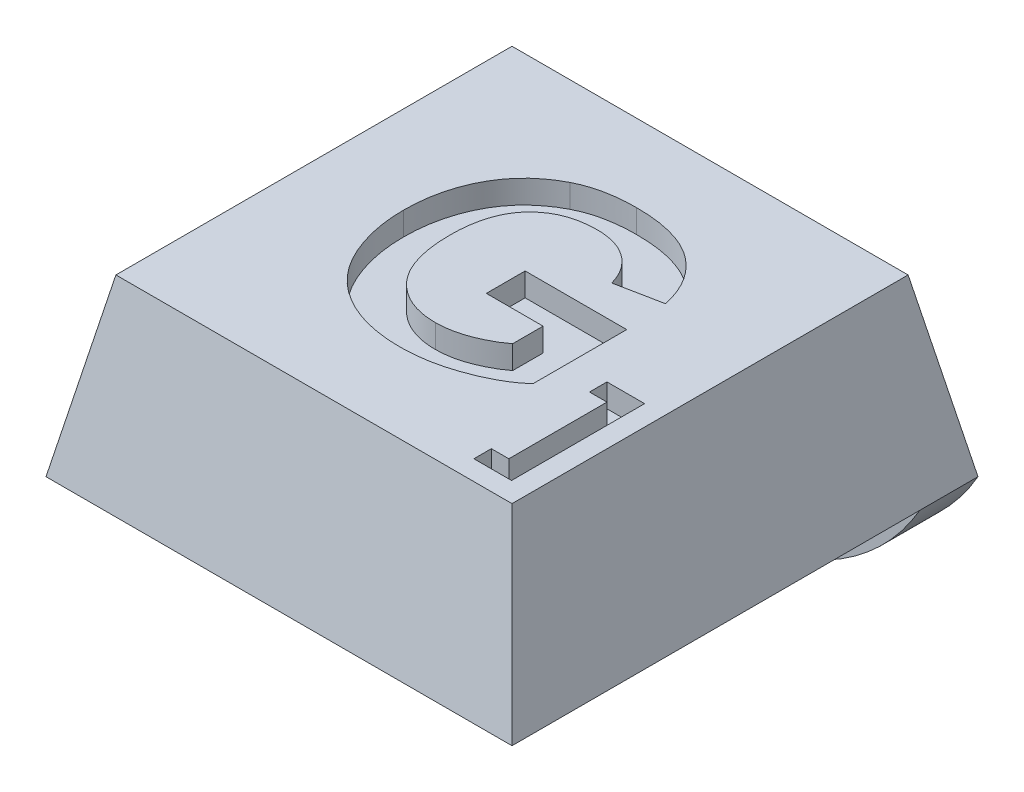
from build123d import *

# Parameters (mm, degrees)
SKETCH1_W               = 8
SKETCH1_H               = 8
BOSS_EXTRUDE1_DEPTH     = 3
CUT_EXTRUDE1_DEPTH      = 12.704699911
CUT_EXTRUDE1_DEPTH_BACK = 12.704699911
CUT_EXTRUDE2_DEPTH      = 11
SKETCH4_R               = 1.8
CUT_EXTRUDE3_DEPTH      = 0.8
SKETCH5_W               = 8
SKETCH5_H               = 1
BOSS_EXTRUDE2_DEPTH     = 2
FILLET1_R               = 4
CUT_EXTRUDE4_DEPTH      = 0.4
CUT_EXTRUDE5_DEPTH      = 0.4


with BuildPart() as part:
    # Sketch1 → Boss-Extrude1 (new body)
    with BuildSketch(Plane(origin=(0, 0, 0), x_dir=(1, 0, 0), z_dir=(0, 1, 0))):
        with Locations((4, 4)):
            Rectangle(SKETCH1_W, SKETCH1_H)
    extrude(amount=BOSS_EXTRUDE1_DEPTH)

    # Sketch2 → Cut-Extrude1 (cut, two sides: drawn at the far end of the back side and taken through both)
    with BuildSketch(Plane.XY.offset(-CUT_EXTRUDE1_DEPTH_BACK)):
        Polygon((0, 0), (0.6, 3), (0, 3), align=None)
        Polygon((8, 0), (7.4, 3), (8, 3), align=None)
    extrude(amount=CUT_EXTRUDE1_DEPTH + CUT_EXTRUDE1_DEPTH_BACK, mode=Mode.SUBTRACT)

    # Sketch3 → Cut-Extrude2 (cut)
    with BuildSketch(Plane(origin=(0, 0, 0), x_dir=(0, 0, -1), z_dir=(1, 0, 0))):
        Polygon((0, 0), (0.6, 3), (0, 3), align=None)
        Polygon((8, 3), (7.4, 3), (8, 0), align=None)
    extrude(amount=CUT_EXTRUDE2_DEPTH, mode=Mode.SUBTRACT)

    # Sketch4 → Cut-Extrude3 (cut)
    with BuildSketch(Plane.XZ):
        with Locations(Location((4, -3.75, 0), (0, 0, 270))):
            Circle(SKETCH4_R)
    extrude(amount=-CUT_EXTRUDE3_DEPTH, mode=Mode.SUBTRACT)

    # Sketch5 → Boss-Extrude2 (add)
    with BuildSketch(Plane.XZ):
        with Locations((4, -7.5)):
            Rectangle(SKETCH5_W, SKETCH5_H)
    extrude(amount=BOSS_EXTRUDE2_DEPTH)

    # Fillet1
    # the kernel refuses this fillet: 4 mm, written as the material it takes off along each edge
    with BuildSketch(Plane(origin=(8, -2, -16.660254038), x_dir=(0, 1, 0), z_dir=(0, 0, 1)), Plane(origin=(0, -2, 1.660254038), x_dir=(0, 1, 0), z_dir=(0, 0, -1))) as fillet1_piece_1:
        with BuildLine():
            CenterArc((4, 3.464101615), FILLET1_R, 180, 60)
            Line((0, 3.464101615), (-0.08, 3.464101615))
            Line((-0.08, 3.464101615), (-0.08, 0))
            Line((-0.08, 0), (0, -0.08))
            ThreePointArc((0, -0.08), (1, -0.08), (1.96, -0.069282032))
            Line((1.96, -0.069282032), (2, 0))
        make_face()
    extrude(amount=18.320508076, mode=Mode.SUBTRACT)

    # Sketch6 → Cut-Extrude4 (cut)
    with BuildSketch(Plane(origin=(0, 3, 0), x_dir=(1, 0, 0), z_dir=(0, 1, 0))):
        with BuildLine():
            Line((4.053794593, 3.505457585), (4.053794593, 4.172124252))
            Line((4.053794593, 4.172124252), (5.797384337, 4.172124252))
            Line((5.797384337, 4.172124252), (5.797384337, 2.564752457))
            add(Edge.make_bspline(
                [(5.797384337, 2.564752457), (5.775440275, 2.544992361), (5.730582172, 2.504598726), (5.657391115, 2.447633596), (5.576814656, 2.393249062), (5.489339896, 2.340343698), (5.394785806, 2.289343315), (5.293529517, 2.239537607), (5.185384208, 2.19141366), (5.032450931, 2.131128575), (4.835594452, 2.065533422), (4.594933471, 2.008496304), (4.352368706, 1.973513189), (4.190125473, 1.969167013), (4.109083055, 1.966996047)],
                knots=[0, 0, 0, 0, 0.581799769, 1.189316438, 1.825828404, 2.496525428, 3.203088405, 3.942228803, 4.719818701, 5.534979611, 7.181138583, 8.803804008, 10.403462225, 12, 12, 12, 12], degree=3))
            add(Edge.make_bspline(
                [(4.109083055, 1.966996047), (4.058312627, 1.967758979), (3.958229013, 1.969262944), (3.810482794, 1.981368296), (3.667847904, 2.002080495), (3.530208107, 2.031409962), (3.397097502, 2.066765974), (3.26907094, 2.111868039), (3.146582956, 2.166009466), (3.028523806, 2.226338905), (2.917094396, 2.295632176), (2.812187083, 2.371432832), (2.714561168, 2.454400196), (2.624566637, 2.544701507), (2.540998329, 2.641714843), (2.464831298, 2.745902822), (2.396526155, 2.857385727), (2.335239765, 2.974765127), (2.280716867, 3.097008702), (2.234709094, 3.223154334), (2.194374003, 3.351370526), (2.161222966, 3.482107416), (2.136875151, 3.615790052), (2.117947657, 3.751799892), (2.107781758, 3.890986734), (2.105984472, 3.984609884), (2.105076645, 4.031899893)],
                knots=[0, 0, 0, 0, 1.124918047, 2.217548049, 3.282233239, 4.316494221, 5.334437038, 6.332151046, 7.320712088, 8.300141923, 9.267552434, 10.225301062, 11.165776911, 12.103230934, 13.047553934, 14.000517593, 14.959782875, 15.941944936, 16.932894943, 17.923491392, 18.915624898, 19.910402922, 20.909870877, 21.92519501, 22.95199481, 24, 24, 24, 24], degree=3))
            add(Edge.make_bspline(
                [(2.105076645, 4.031899893), (2.105812881, 4.082940857), (2.107264322, 4.183564655), (2.119773705, 4.33228546), (2.139199297, 4.476648194), (2.168656936, 4.616390773), (2.20449512, 4.75216369), (2.248233589, 4.883877531), (2.301822866, 5.010556427), (2.361436063, 5.133283761), (2.429297714, 5.250362339), (2.505977563, 5.360290437), (2.589206445, 5.464176802), (2.680629029, 5.560371285), (2.779923369, 5.648827012), (2.886080088, 5.730522243), (2.998844963, 5.806865303), (3.079553832, 5.849911113), (3.120301004, 5.871643482)],
                knots=[0, 0, 0, 0, 1.105010302, 2.178452875, 3.229459892, 4.257086284, 5.268538906, 6.268935615, 7.259234261, 8.24469117, 9.221745683, 10.185929258, 11.144249683, 12.101504986, 13.055838221, 14.020611351, 15.000673771, 16, 16, 16, 16], degree=3))
            add(Edge.make_bspline(
                [(3.120301004, 5.871643482), (3.152638085, 5.887700047), (3.218317351, 5.920312247), (3.322813337, 5.959248923), (3.432101667, 5.994677516), (3.547832356, 6.021111591), (3.6692195, 6.042829226), (3.796209305, 6.059036287), (3.929210312, 6.067547239), (4.019595582, 6.068879104), (4.065813824, 6.069560149)],
                knots=[0, 0, 0, 0, 0.887969848, 1.803539625, 2.741143579, 3.713741423, 4.722068772, 5.775476617, 6.8624965, 8, 8, 8, 8], degree=3))
            add(Edge.make_bspline(
                [(4.065813824, 6.069560149), (4.125403824, 6.06867255), (4.241295356, 6.066946335), (4.410256532, 6.05256252), (4.569271079, 6.027772487), (4.718560435, 5.993629866), (4.857802985, 5.949731518), (4.986759025, 5.895763799), (5.106220057, 5.832812796), (5.214455834, 5.758355608), (5.313666102, 5.676257846), (5.403591975, 5.586419647), (5.48426965, 5.488707943), (5.555752499, 5.383614392), (5.617477906, 5.2707046), (5.670549966, 5.151008328), (5.714234697, 5.023616882), (5.73534656, 4.935145779), (5.746102286, 4.89007297)],
                knots=[0, 0, 0, 0, 1.271135529, 2.472123572, 3.614091059, 4.701890498, 5.736279567, 6.724681829, 7.680621489, 8.611506429, 9.52200816, 10.424540711, 11.318996785, 12.221421405, 13.131851814, 14.060431888, 15.011860567, 16, 16, 16, 16], degree=3))
            Line((5.746102286, 4.89007297), (4.976871517, 4.736226816))
            add(Edge.make_bspline(
                [(4.976871517, 4.736226816), (4.969254672, 4.761468809), (4.95422678, 4.81127079), (4.925094227, 4.882758251), (4.891539922, 4.949961192), (4.853483379, 5.013366036), (4.810541206, 5.072582433), (4.761675926, 5.126971617), (4.709961453, 5.179014495), (4.652020351, 5.225088646), (4.590259767, 5.266624284), (4.52537561, 5.304078684), (4.455901775, 5.334453158), (4.382811411, 5.358892727), (4.306461756, 5.37964837), (4.225856415, 5.392413169), (4.141900573, 5.402040295), (4.084540473, 5.402606041), (4.055397158, 5.402893482)],
                knots=[0, 0, 0, 0, 1.027736275, 2.027704492, 3.005900071, 3.954421694, 4.908588141, 5.853155543, 6.803277083, 7.766271258, 8.734041521, 9.704274878, 10.683578894, 11.68490234, 12.708089448, 13.76461009, 14.864251086, 16, 16, 16, 16], degree=3))
            add(Edge.make_bspline(
                [(4.055397158, 5.402893482), (4.01128773, 5.401716629), (3.925204424, 5.399419898), (3.799534269, 5.384433236), (3.680976007, 5.357770589), (3.569219615, 5.320994553), (3.46406021, 5.273789934), (3.366918824, 5.2143961), (3.275376693, 5.146327474), (3.192038786, 5.066438045), (3.116460773, 4.976859168), (3.051034483, 4.876522357), (2.996567377, 4.765751945), (2.951955713, 4.645104141), (2.91643531, 4.514573915), (2.892338718, 4.373699188), (2.876594443, 4.222696077), (2.875085403, 4.118480819), (2.874307414, 4.064752457)],
                knots=[0, 0, 0, 0, 1.043810997, 2.037086103, 2.989314757, 3.91471467, 4.817033861, 5.710208705, 6.603920097, 7.511448416, 8.435617211, 9.371747005, 10.338444094, 11.350425613, 12.411431869, 13.5347293, 14.729025275, 16, 16, 16, 16], degree=3))
            add(Edge.make_bspline(
                [(2.874307414, 4.064752457), (2.875118698, 4.00702506), (2.876695474, 3.894828493), (2.892027057, 3.732262921), (2.917247643, 3.580803592), (2.95342224, 3.44064155), (2.998941149, 3.311279521), (3.053656914, 3.192304252), (3.121182779, 3.085923464), (3.197244894, 2.990004781), (3.28225913, 2.906191636), (3.37384152, 2.833121051), (3.471482188, 2.77119638), (3.576081527, 2.721395085), (3.686320303, 2.681751972), (3.80321198, 2.653959398), (3.926408504, 2.636695674), (4.010734238, 2.634687946), (4.053794593, 2.633662713)],
                knots=[0, 0, 0, 0, 1.318042826, 2.561693173, 3.724929596, 4.821196409, 5.862977565, 6.853497791, 7.804600806, 8.73339865, 9.643480846, 10.524649628, 11.404635349, 12.277659519, 13.165160235, 14.075017549, 15.017020959, 16, 16, 16, 16], degree=3))
            add(Edge.make_bspline(
                [(4.053794593, 2.633662713), (4.097408334, 2.634875039), (4.185053042, 2.637311287), (4.316328539, 2.657956024), (4.448117665, 2.68833542), (4.577327471, 2.734163302), (4.70281192, 2.786727561), (4.819965055, 2.847306941), (4.929675356, 2.910453005), (4.995733738, 2.959668979), (5.028153568, 2.98382297)],
                knots=[0, 0, 0, 0, 0.993821502, 1.997150276, 3.023717651, 4.073291794, 5.118404464, 6.123376694, 7.078999408, 8, 8, 8, 8], degree=3))
            Line((5.028153568, 2.98382297), (5.028153568, 3.505457585))
            Line((5.028153568, 3.505457585), (4.053794593, 3.505457585))
        make_face()
    extrude(amount=-CUT_EXTRUDE4_DEPTH, mode=Mode.SUBTRACT)

    # Sketch7 → Cut-Extrude5 (cut)
    with BuildSketch(Plane(origin=(0, 3, 0), x_dir=(1, 0, 0), z_dir=(0, 1, 0))):
        Polygon((7.051946272, 3.224540865), (7.051946272, 0.93992548), (6.405792426, 0.93992548), (6.405792426, 1.23992548), (6.705792426, 1.23992548), (6.705792426, 2.924540865), (6.405792426, 2.924540865), (6.405792426, 3.224540865), align=None)
    extrude(amount=-CUT_EXTRUDE5_DEPTH, mode=Mode.SUBTRACT)


solid = part.part
